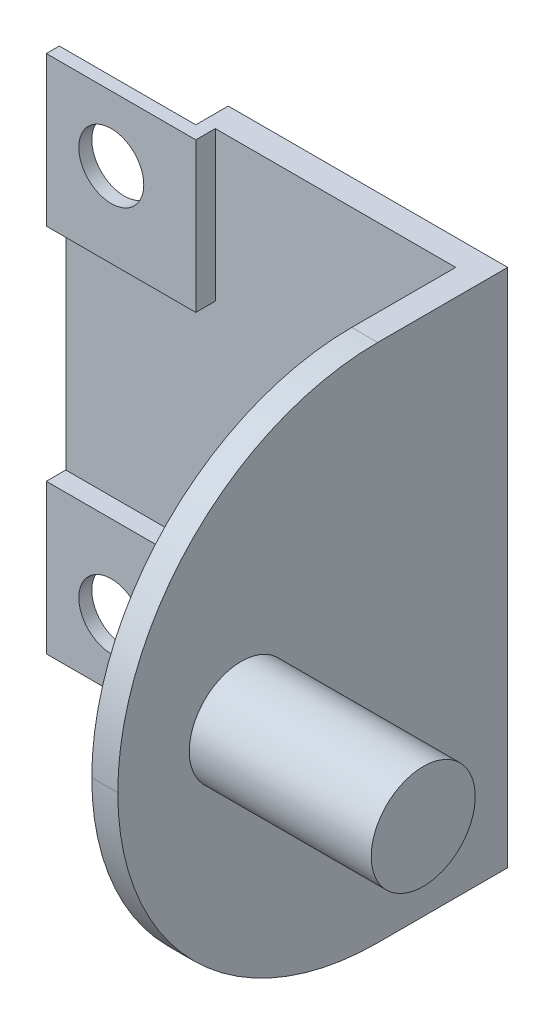
from build123d import *

# Parameters (mm, degrees)
ESQUISSE1_W             = 32
ESQUISSE1_H             = 40
BOSS_EXTRU_1_DEPTH      = 2
ESQUISSE2_W             = 2
ESQUISSE2_H             = 40
BOSS_EXTRU_2_DEPTH      = 28
CONG_1_R                = 20
ESQUISSE3_R             = 4
ENL_V_MAT_EXTRU_1_DEPTH = 30
ESQUISSE4_W             = 10.5
ESQUISSE4_H             = 10.5
ENL_V_MAT_EXTRU_2_DEPTH = 30
ESQUISSE5_W             = 1
ESQUISSE5_H             = 1
ESQUISSE5_W_2           = 10.5
ESQUISSE5_H_2           = 10.5
BOSS_EXTRU_5_DEPTH      = 1.5
ESQUISSE6_W             = 1
ESQUISSE6_H             = 10.5
BOSS_EXTRU_6_DEPTH      = 10.5
ESQUISSE7_R             = 2.5
ENL_V_MAT_EXTRU_3_DEPTH = 10.5
BOSS_EXTRU_7_START      = -16
ESQUISSE8_R             = 4
BOSS_EXTRU_7_DEPTH      = 16


with BuildPart() as part:
    # Esquisse1 → Boss.-Extru.1 (new body)
    with BuildSketch(Plane.XY):
        with Locations((-16, 20)):
            Rectangle(ESQUISSE1_W, ESQUISSE1_H)
    extrude(amount=BOSS_EXTRU_1_DEPTH)

    # Esquisse2 → Boss.-Extru.2 (add)
    with BuildSketch(Plane.XY.offset(2)):
        with Locations((-1, 20)):
            Rectangle(ESQUISSE2_W, ESQUISSE2_H)
    extrude(amount=BOSS_EXTRU_2_DEPTH)

    # Congé1
    cong_1_edges = [part.edges().sort_by_distance(p)[0] for p in [
        (-1, 40, 30),
        (-1, 0, 30),
    ]]
    fillet(cong_1_edges, radius=CONG_1_R - 0.0001)  # a hair under: the kernel refuses the full size

    # Esquisse3 → Enlèv. mat.-Extru.1 (cut)
    with BuildSketch(Plane(origin=(0, 0, 0), x_dir=(0, 0, -1), z_dir=(1, 0, 0))):
        with Locations(Location((-20.5, 20, 0), (0, 0, 90))):
            Circle(ESQUISSE3_R)
    extrude(amount=-ENL_V_MAT_EXTRU_1_DEPTH, mode=Mode.SUBTRACT)

    # Esquisse4 → Enlèv. mat.-Extru.2 (cut)
    with BuildSketch(Plane.XY.offset(2)):
        with Locations((-26.75, 34.75)):
            Rectangle(ESQUISSE4_W, ESQUISSE4_H)
        with Locations((-26.75, 5.25)):
            Rectangle(ESQUISSE4_W, ESQUISSE4_H)
    extrude(amount=-ENL_V_MAT_EXTRU_2_DEPTH, mode=Mode.SUBTRACT)

    # Esquisse5 → Boss.-Extru.5 (add)
    with BuildSketch(Plane.XY.offset(2)):
        with Locations((-21, 29)):
            Rectangle(ESQUISSE5_W, ESQUISSE5_H)
        with Locations((-26.75, 29)):
            Rectangle(ESQUISSE5_W_2, ESQUISSE5_H)
        with Locations((-21, 34.75)):
            Rectangle(ESQUISSE5_W, ESQUISSE5_H_2)
        with Locations((-21, 11)):
            Rectangle(ESQUISSE5_W, ESQUISSE5_H)
        with Locations((-21, 5.25)):
            Rectangle(ESQUISSE5_W, ESQUISSE5_H_2)
        with Locations((-26.75, 11)):
            Rectangle(ESQUISSE5_W_2, ESQUISSE5_H)
    extrude(amount=BOSS_EXTRU_5_DEPTH)

    # Esquisse6 → Boss.-Extru.6 (add)
    with BuildSketch(Plane.ZY.offset(21.5)):
        with Locations((3, 34.75)):
            Rectangle(ESQUISSE6_W, ESQUISSE6_H)
        with Locations((3, 5.25)):
            Rectangle(ESQUISSE6_W, ESQUISSE6_H)
    extrude(amount=BOSS_EXTRU_6_DEPTH)

    # Esquisse7 → Enlèv. mat.-Extru.3 (cut)
    with BuildSketch(Plane.XY.offset(3.5)):
        with Locations((-27, 35)):
            Circle(ESQUISSE7_R)
        with Locations((-27, 5)):
            Circle(ESQUISSE7_R)
    extrude(amount=-ENL_V_MAT_EXTRU_3_DEPTH, mode=Mode.SUBTRACT)

    # Esquisse8 → Boss.-Extru.7 (add)
    with BuildSketch(Plane.ZY.offset(2).offset(BOSS_EXTRU_7_START)):
        with Locations((20.5, 20)):
            Circle(ESQUISSE8_R)
    extrude(amount=BOSS_EXTRU_7_DEPTH)


solid = part.part
